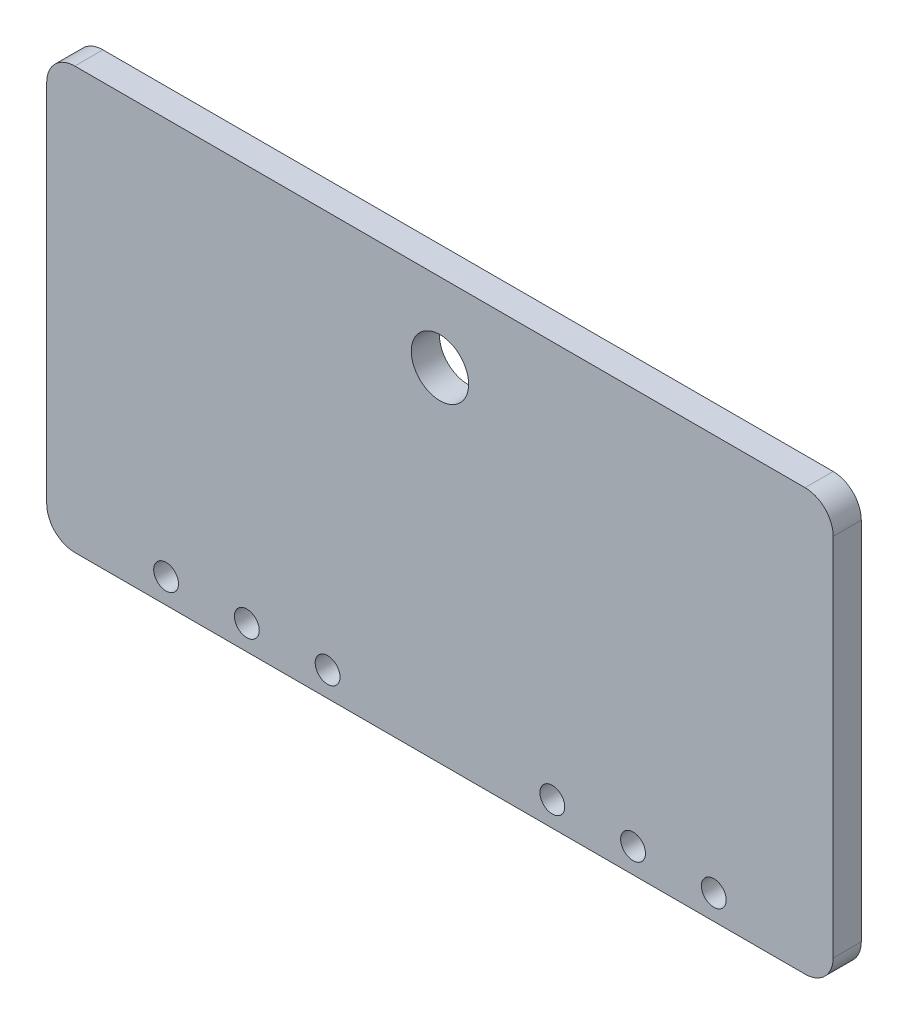
from build123d import *

# Parameters (mm, degrees)
SKETCH1_W              = 177.8
SKETCH1_H              = 95.25
BOSS_EXTRUDE1_DEPTH    = 6.35
F_10_CLEARANCE_HOLE1_D = 5.6134
SKETCH8_R              = 6.477
CUT_EXTRUDE1_DEPTH     = 202.806156992
FILLET1_R              = 6.35


with BuildPart() as part:
    # Sketch1 → Boss-Extrude1 (new body)
    with BuildSketch(Plane.XY):
        with Locations((88.9, 47.625)):
            Rectangle(SKETCH1_W, SKETCH1_H)
    extrude(amount=BOSS_EXTRUDE1_DEPTH)

    # #10 Clearance Hole1 (through all)
    with Locations(Plane.XY.offset(6.35)):
        with Locations((26.9875, 5.588), (63.5, 5.588), (114.3, 5.588), (150.8125, 5.588), (45.24375, 5.588), (132.55625, 5.588)):
            Hole(F_10_CLEARANCE_HOLE1_D / 2)

    # Sketch8 → Cut-Extrude1 (cut, through all)
    with BuildSketch(Plane.XY.offset(6.35)):
        with Locations((88.9, 77.47)):
            Circle(SKETCH8_R)
    extrude(amount=-CUT_EXTRUDE1_DEPTH, mode=Mode.SUBTRACT)

    # Fillet1
    fillet1_edges = [part.edges().sort_by_distance(p)[0] for p in [
        (177.8, 0, 3.175),
        (177.8, 95.25, 3.175),
        (0, 95.25, 3.175),
        (0, 0, 3.175),
    ]]
    fillet(fillet1_edges, radius=FILLET1_R)


solid = part.part
